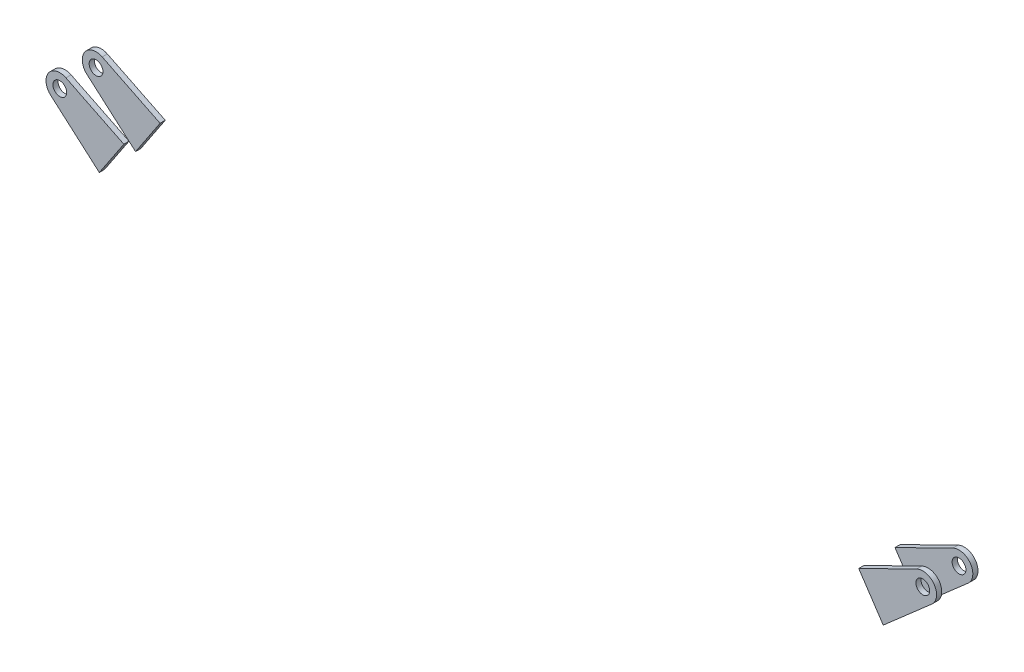
from build123d import *

# Parameters (mm, degrees)
BOSS_EXTRUDE1_START     = 141
BOSS_EXTRUDE1_OUTLINE_R = 4
BOSS_EXTRUDE1_DEPTH     = 3


# Read off the part's stored shape, not the designer's step: Boss-Extrude1
with BuildPart() as part:
    # Boss-Extrude1 outline → Boss-Extrude1 (new body)
    with BuildSketch(Plane.XY.offset(BOSS_EXTRUDE1_START)):
        with BuildLine():
            Line((212.894680975, -2239.342021462), (227.105319025, -2260.657978538))
            Line((227.105319025, -2260.657978538), (255.267429793, -2236.02114469))
            ThreePointArc((255.267429793, -2236.02114469), (256.656402355, -2225.56239843), (246.467954822, -2222.821932233))
            Line((246.467954822, -2222.821932233), (212.894680975, -2239.342021462))
        make_face()
        with Locations((250, -2230)):
            Circle(BOSS_EXTRUDE1_OUTLINE_R, mode=Mode.SUBTRACT)
    extrude(amount=BOSS_EXTRUDE1_DEPTH)


with BuildPart() as body_2:
    # Mirror1: mirrored copy
    add(part.part.mirror(Plane(origin=(0, 0, 132), x_dir=(1, 0, 0), z_dir=(0, 0, -1))))


with BuildPart() as body_3:
    # Mirror2: mirrored copy
    add(part.part.mirror(Plane(origin=(0, 0, 0), x_dir=(0, 0, 1), z_dir=(1, 0, 0))))


with BuildPart() as body_4:
    # Mirror2 2: mirrored copy
    add(body_2.part.mirror(Plane(origin=(0, 0, 0), x_dir=(0, 0, 1), z_dir=(1, 0, 0))))


solid = Compound([part.part, body_2.part, body_3.part, body_4.part])
